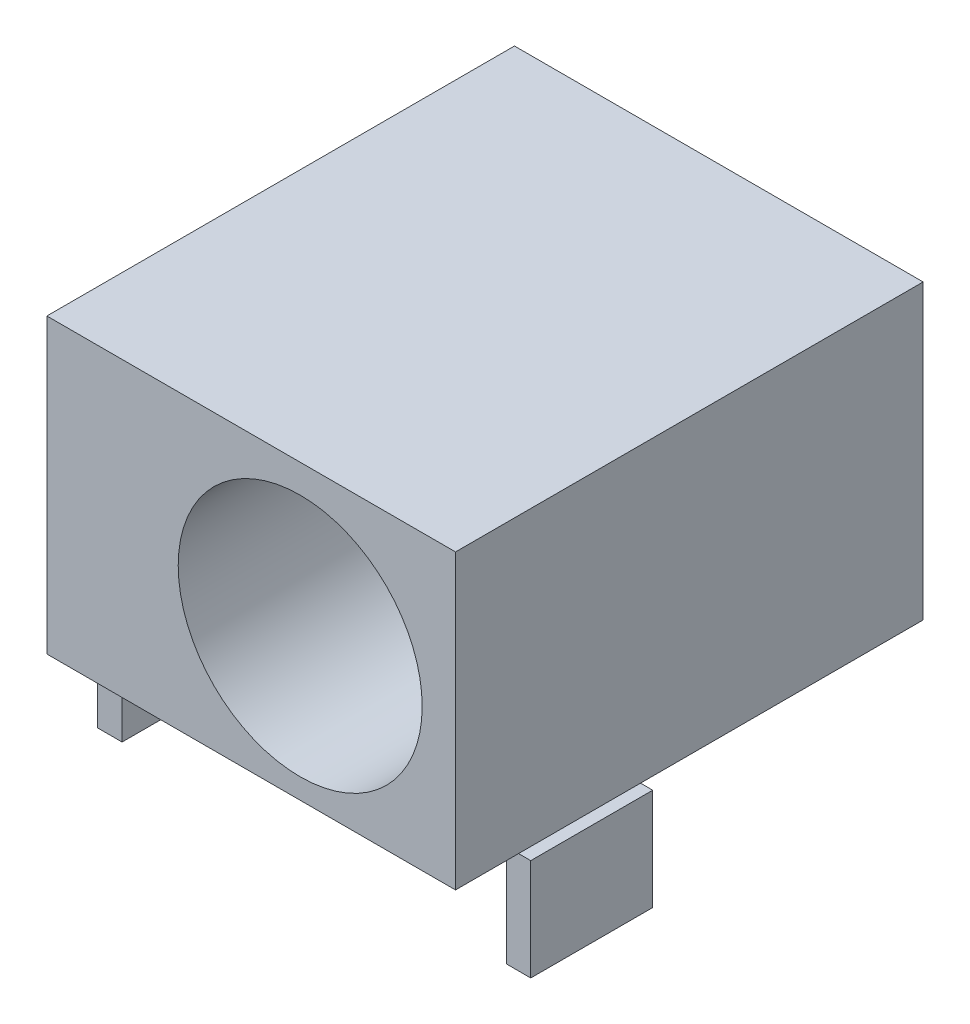
from build123d import *

# Parameters (mm, degrees)
SKETCH1_W             = 0.6
SKETCH1_H             = 3
BOSS_EXTRUDE1_DEPTH   = 2.5
BOSS_EXTRUDE1_2_DEPTH = 2.5
SKETCH1_3_W           = 10.05
SKETCH1_3_H           = 11.5
BOSS_EXTRUDE2_DEPTH   = 7.2
F_3DSKETCH2_R         = 3
CUT_EXTRUDE1_DEPTH    = 8.2


with BuildPart() as part:
    # Sketch1 → Boss-Extrude1 (new body)
    with BuildSketch(Plane(origin=(0, 0, 0), x_dir=(1, 0, 0), z_dir=(0, 1, 0))):
        with Locations((-5.025, -2.7)):
            Rectangle(SKETCH1_W, SKETCH1_H)
    extrude(amount=-BOSS_EXTRUDE1_DEPTH)



with BuildPart() as body_2:
    # Sketch1 → Boss-Extrude1 2 (new body)
    with BuildSketch(Plane(origin=(0, 0, 0), x_dir=(1, 0, 0), z_dir=(0, 1, 0))):
        with Locations((5.025, -2.7)):
            Rectangle(SKETCH1_W, SKETCH1_H)
    extrude(amount=-BOSS_EXTRUDE1_2_DEPTH)


with BuildPart() as part_1:
    add(part.part)

    add(body_2.part)  # Boss-Extrude2 merges body 2
    # Sketch1<3> → Boss-Extrude2 (add)
    with BuildSketch(Plane(origin=(0, 0, 0), x_dir=(1, 0, 0), z_dir=(0, 1, 0))):
        Rectangle(SKETCH1_3_W, SKETCH1_3_H)
    extrude(amount=BOSS_EXTRUDE2_DEPTH)

    # 3DSketch2 → Cut-Extrude1 (cut)
    with BuildSketch(Plane(origin=(1.205, 3.5, 5.75), x_dir=(-1, 0, 0), z_dir=(0, 0, -1))):
        Circle(F_3DSKETCH2_R)
    extrude(amount=CUT_EXTRUDE1_DEPTH, mode=Mode.SUBTRACT)


solid = part_1.part
